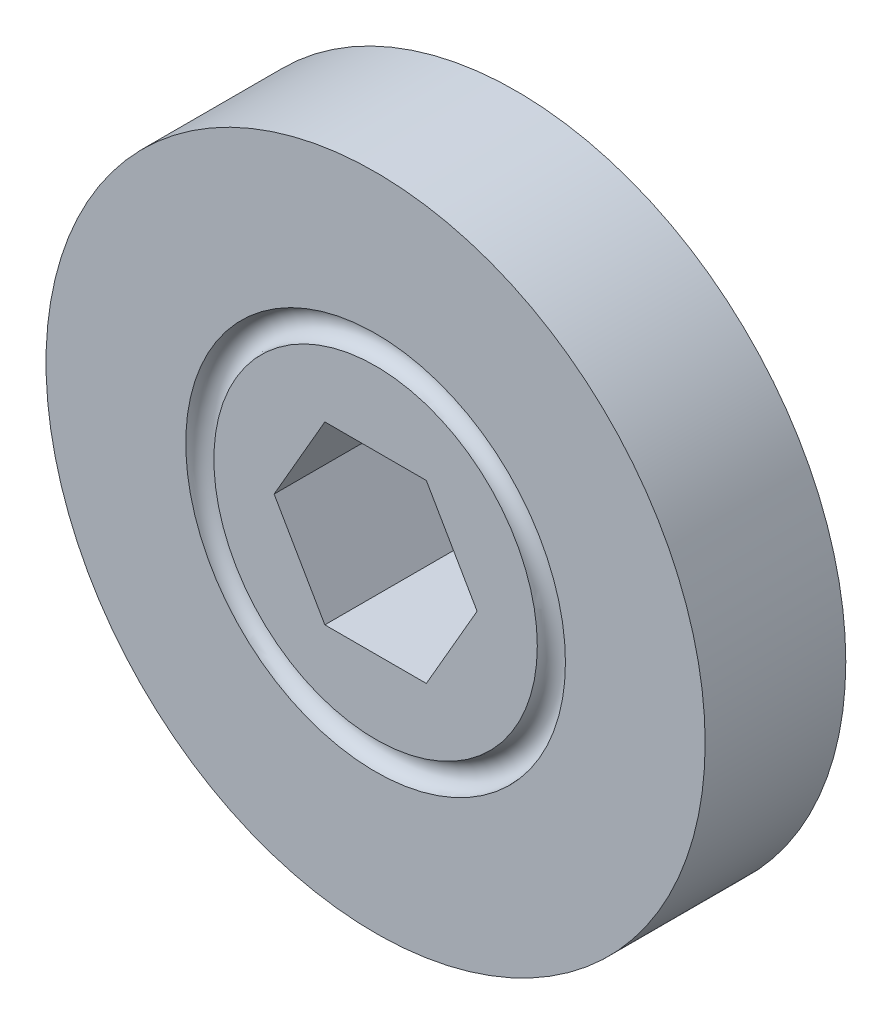
from build123d import *

# Parameters (mm, degrees)
CUT_EXTRUDE1_REACH = 37.175


with BuildPart() as part:
    # Sketch1 → Revolve1 (revolve)
    with BuildSketch(Plane(origin=(0, 0, 0), x_dir=(0, 0, -1), z_dir=(1, 0, 0))):
        with BuildLine():
            Line((-5.08, 23.8125), (5.08, 23.8125))
            Line((5.08, 23.8125), (5.08, 13.716))
            ThreePointArc((5.08, 13.716), (4.064, 12.7), (5.08, 11.684))
            Line((5.08, 11.684), (5.08, 0))
            Line((5.08, 0), (-5.08, 0))
            Line((-5.08, 0), (-5.08, 11.684))
            ThreePointArc((-5.08, 11.684), (-4.064, 12.7), (-5.08, 13.716))
            Line((-5.08, 13.716), (-5.08, 23.8125))
        make_face()
    revolve(axis=Axis((0, 0, 5.08), (0, 0, -1)))

    # Sketch2 → Cut-Extrude1 (cut, up to next)
    with BuildSketch(Plane.XY.offset(5.08), mode=Mode.PRIVATE) as cut_extrude1_sk1:
        Polygon((-3.666174209, 6.35), (-7.332348419, 0), (-3.666174209, -6.35), (3.666174209, -6.35), (7.332348419, 0), (3.666174209, 6.35), align=None)
    cut_extrude1_tool1 = extrude(cut_extrude1_sk1.sketch, amount=-CUT_EXTRUDE1_REACH, mode=Mode.PRIVATE) & part.part
    add(cut_extrude1_tool1.solids().sort_by_distance((0, 0, 5.08))[0], mode=Mode.SUBTRACT)


solid = part.part
